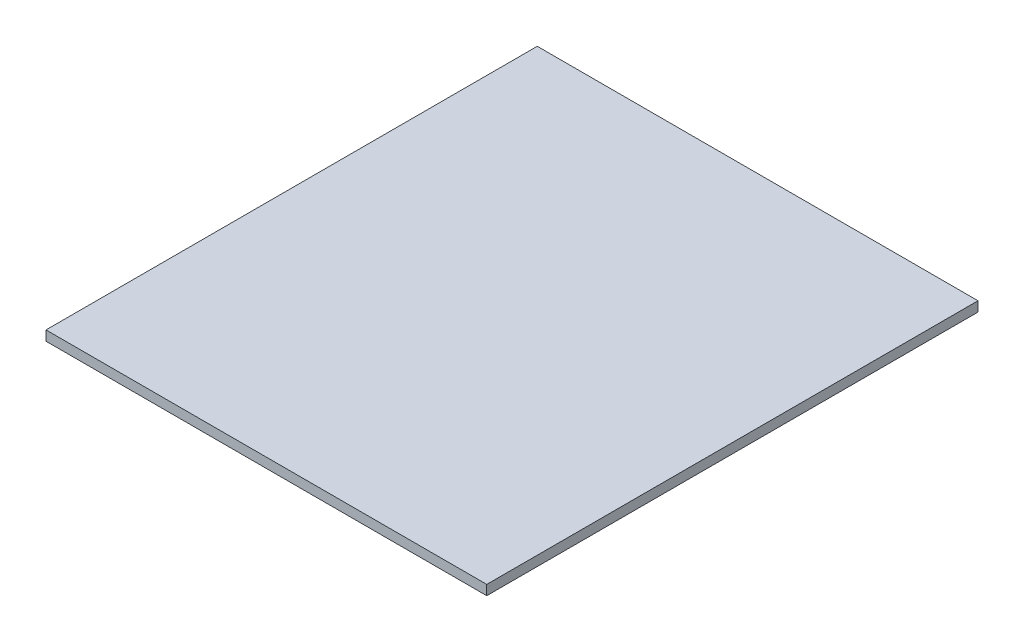
from build123d import *

# Parameters (mm, degrees)
SKETCH2_W           = 134.58
SKETCH2_H           = 3
BOSS_EXTRUDE1_DEPTH = 150


with BuildPart() as part:
    # Sketch2 → Boss-Extrude1 (new body)
    with BuildSketch(Plane.XY):
        with Locations((67.29, -1.5)):
            Rectangle(SKETCH2_W, SKETCH2_H)
    extrude(amount=BOSS_EXTRUDE1_DEPTH)


solid = part.part
